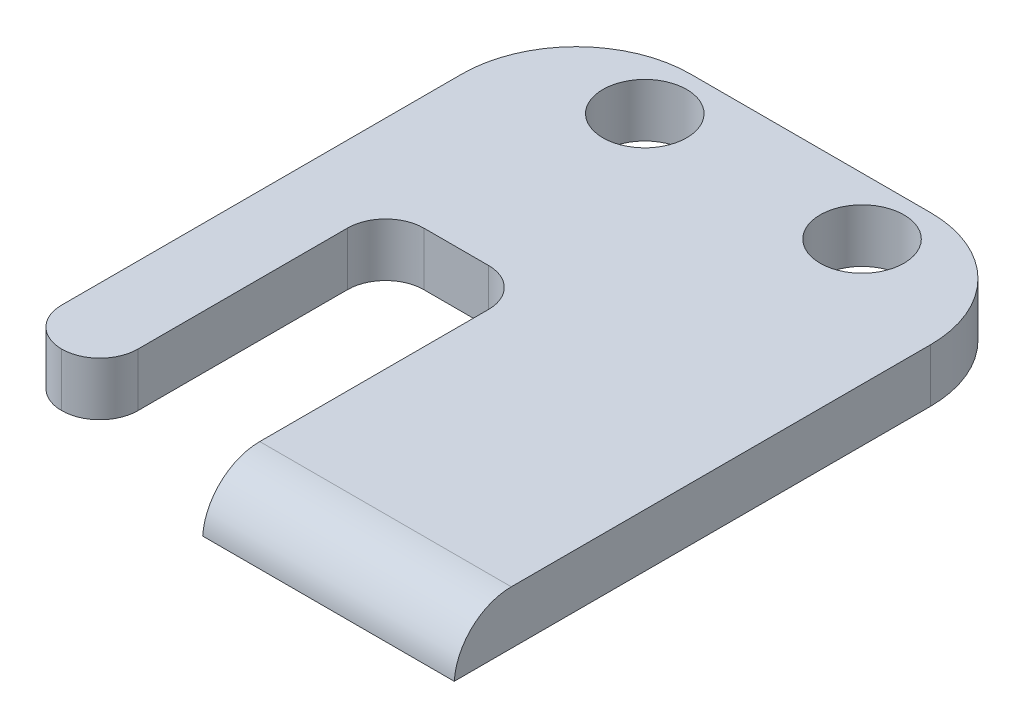
from build123d import *

# Parameters (mm, degrees)
BOSS_EXTRUDE1_DEPTH = 2.8
SKETCH4_R           = 2.2
CUT_EXTRUDE3_DEPTH  = 6
FILLET1_R           = 6
FILLET2_START       = -1
FILLET2_DEPTH       = 5
FILLET2_2_DEPTH     = 2.8
CUT_EXTRUDE7_START  = -2.8
SKETCH7_W           = 9
SKETCH7_H           = 11.2
CUT_EXTRUDE7_DEPTH  = 2.2
FILLET5_R           = 3


with BuildPart() as part:
    # Sketch1 → Boss-Extrude1 (new body)
    with BuildSketch(Plane(origin=(0, 0, 0), x_dir=(1, 0, 0), z_dir=(0, 1, 0))):
        Polygon((-16.635707691, 6.623874564), (7.964292309, 6.623874564), (7.964292309, -24.376125436), (-5.235707691, -24.376125436), (-5.235707691, -7.376125436), (-12.635707691, -7.376125436), (-12.635707691, -22.376125436), (-16.635707691, -22.376125436), align=None)
    extrude(amount=BOSS_EXTRUDE1_DEPTH)

    # Sketch4 → Cut-Extrude3 (cut)
    with BuildSketch(Plane(origin=(0, 2.8, 0), x_dir=(1, 0, 0), z_dir=(0, 1, 0))):
        with Locations(Location((-10.035707691, 3.623874564, 0), (0, 0, 270))):
            Circle(SKETCH4_R)
        with Locations(Location((1.364292309, 3.623874564, 0), (0, 0, 270))):
            Circle(SKETCH4_R)
    extrude(amount=-CUT_EXTRUDE3_DEPTH, mode=Mode.SUBTRACT)

    # Fillet1
    fillet1_edges = [part.edges().sort_by_distance(p)[0] for p in [
        (-16.635707691, 1.4, -6.623874564),
        (7.964292309, 1.4, -6.623874564),
    ]]
    fillet(fillet1_edges, radius=FILLET1_R)

    # Fillet2: read off the stored shape, not the designer's step
    # Fillet2 outline → Fillet2 (cut)
    with BuildSketch(Plane(origin=(0, 0, 0), x_dir=(1, 0, 0), z_dir=(0, 1, 0)).offset(FILLET2_START)):
        with BuildLine():
            Line((-16.635707691, -22.376125436), (-14.635707691, -22.376125436))
            ThreePointArc((-14.635707691, -22.376125436), (-16.049921254, -21.790338998), (-16.635707691, -20.376125436))
            Line((-16.635707691, -20.376125436), (-16.635707691, -22.376125436))
        make_face()
        with BuildLine():
            Line((-12.635707691, -22.376125436), (-12.635707691, -20.376125436))
            ThreePointArc((-12.635707691, -20.376125436), (-13.221494128, -21.790338999), (-14.635707691, -22.376125436))
            Line((-14.635707691, -22.376125436), (-12.635707691, -22.376125436))
        make_face()
    extrude(amount=FILLET2_DEPTH, mode=Mode.SUBTRACT)

    # Fillet2 2 outline → Fillet2 2 (add)
    with BuildSketch(Plane(origin=(0, 0, 0), x_dir=(1, 0, 0), z_dir=(0, 1, 0))):
        with BuildLine():
            ThreePointArc((-12.635707691, -9.376125436), (-12.049921253, -7.961911874), (-10.635707691, -7.376125436))
            Line((-10.635707691, -7.376125436), (-12.635707691, -7.376125436))
            Line((-12.635707691, -7.376125436), (-12.635707691, -9.376125436))
        make_face()
        with BuildLine():
            ThreePointArc((-7.235707691, -7.376125436), (-5.821494128, -7.961911874), (-5.235707691, -9.376125436))
            Line((-5.235707691, -9.376125436), (-5.235707691, -7.376125436))
            Line((-5.235707691, -7.376125436), (-7.235707691, -7.376125436))
        make_face()
    extrude(amount=FILLET2_2_DEPTH)

    # Sketch7 → Cut-Extrude7 (cut)
    with BuildSketch(Plane(origin=(0, 2.8, 0), x_dir=(1, 0, 0), z_dir=(0, 1, 0)).offset(CUT_EXTRUDE7_START)):
        with Locations((1.464292309, -8.976125436)):
            Rectangle(SKETCH7_W, SKETCH7_H)
    extrude(amount=CUT_EXTRUDE7_DEPTH, mode=Mode.SUBTRACT)

    # Fillet5
    # the kernel refuses this fillet: 3 mm, written as the material it takes off along each edge
    with BuildSketch(Plane(origin=(15.447607083, 2.8, 24.376125436), x_dir=(0, 0, -1), z_dir=(-1, 0, 0))) as fillet5_piece_1:
        with BuildLine():
            CenterArc((2.993325909, 3), FILLET5_R, 183.822553729, 86.177446271)
            Line((0, 2.8), (-0.059866518, 2.796))
            ThreePointArc((-0.059866518, 2.796), (-0.06, 1.4), (-0.06, 0))
            Line((-0.06, 0), (0, -0.06))
            Line((0, -0.06), (2.993325909, -0.06))
            Line((2.993325909, -0.06), (2.993325909, 0))
        make_face()
    extrude(amount=28.166629547, mode=Mode.SUBTRACT)


solid = part.part
